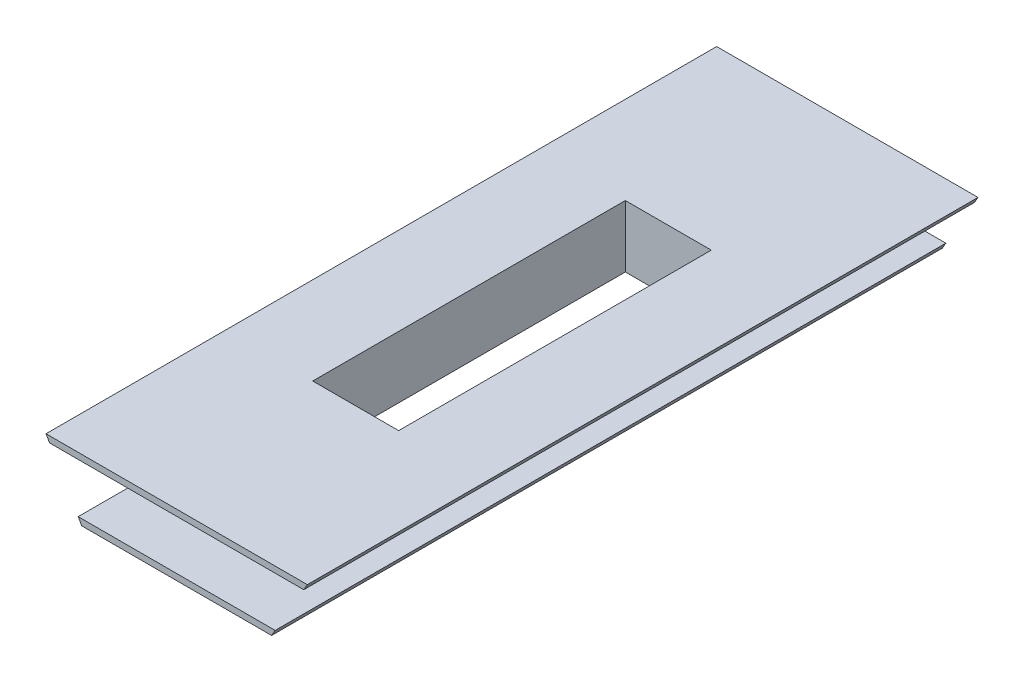
from build123d import *

# Parameters (mm, degrees)
BOSS_EXTRUDE1_DEPTH     = 65
SKETCH5_W               = 9.5282032
SKETCH5_H               = 4.8
CUT_EXTRUDE3_DEPTH      = 16.75
SKETCH6_W               = 9.5282032
SKETCH6_H               = 4.8
CUT_EXTRUDE4_DEPTH      = 16.75
CUT_EXTRUDE5_DEPTH      = 67.493454337
CUT_EXTRUDE5_DEPTH_BACK = 67.493454337


with BuildPart() as part:
    # Sketch2 → Boss-Extrude1 (new body)
    with BuildSketch(Plane.XY):
        Polygon((9.2, 0), (-9.2, 0), (-9.546410162, 0.6), (-8.853589838, 0.6), (-4.7641016, 0.6), (-4.7641016, 5.4), (-11.624871131, 5.4), (-12.317691454, 5.4), (-12.664101615, 6), (12.664101615, 6), (12.317691454, 5.4), (11.624871131, 5.4), (4.7641016, 5.4), (4.7641016, 0.6), (8.853589838, 0.6), (9.546410162, 0.6), align=None)
    extrude(amount=BOSS_EXTRUDE1_DEPTH)

    # Sketch5 → Cut-Extrude3 (cut)
    with BuildSketch(Plane(origin=(0, 0, 0), x_dir=(-1, 0, 0), z_dir=(0, 0, -1))):
        with Locations((0, 3)):
            Rectangle(SKETCH5_W, SKETCH5_H)
    extrude(amount=-CUT_EXTRUDE3_DEPTH, mode=Mode.SUBTRACT)

    # Sketch6 → Cut-Extrude4 (cut)
    with BuildSketch(Plane.XY.offset(65)):
        with Locations((0, 3)):
            Rectangle(SKETCH6_W, SKETCH6_H)
    extrude(amount=-CUT_EXTRUDE4_DEPTH, mode=Mode.SUBTRACT)

    # Sketch7 → Cut-Extrude5 (cut, two sides: drawn at the far end of the back side and taken through both)
    with BuildSketch(Plane(origin=(0, 6, 0), x_dir=(1, 0, 0), z_dir=(0, 1, 0)).offset(-CUT_EXTRUDE5_DEPTH_BACK)):
        Polygon((4.1641016, -17.95), (4.1641016, -47.05), (4.1641016, -47.65), (-4.1641016, -47.65), (-4.1641016, -47.05), (-4.1641016, -17.95), (-4.1641016, -17.35), (4.1641016, -17.35), align=None)
    extrude(amount=CUT_EXTRUDE5_DEPTH + CUT_EXTRUDE5_DEPTH_BACK, mode=Mode.SUBTRACT)


solid = part.part
